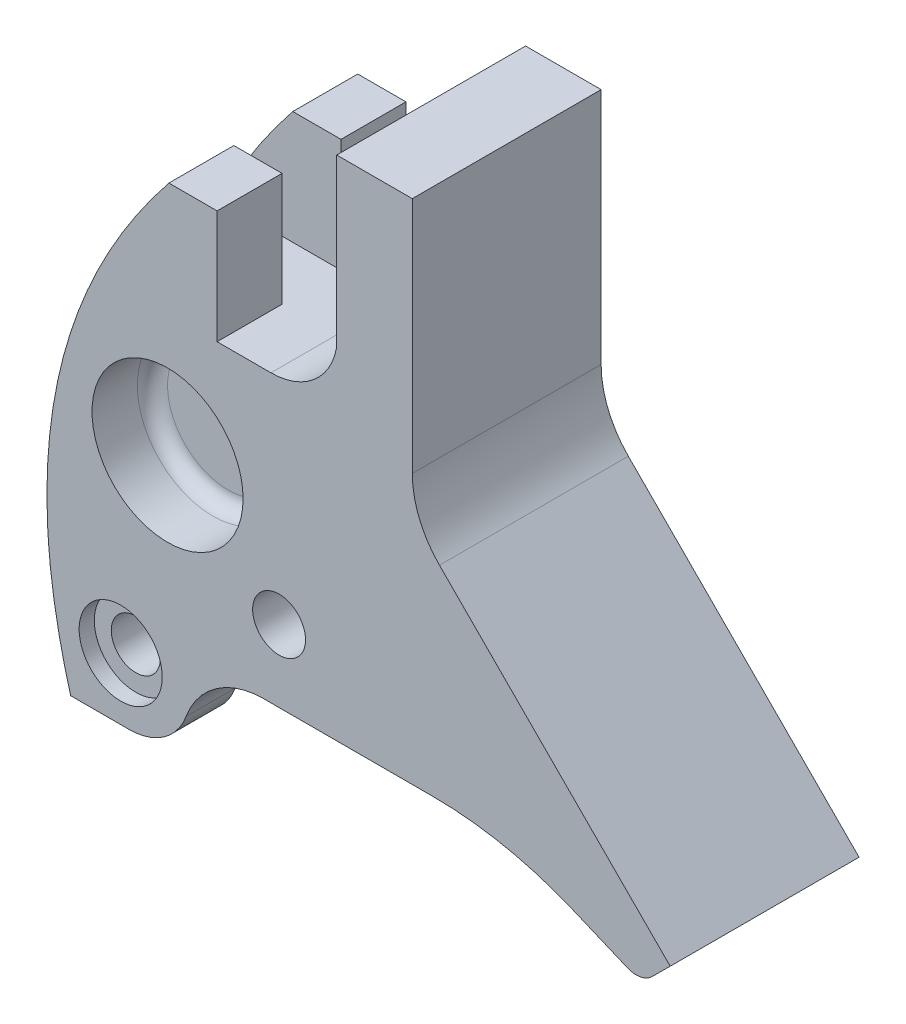
from build123d import *

# Parameters (mm, degrees)
SKETCH1_R           = 3.25
SKETCH1_R_2         = 3.5
BOSS_EXTRUDE1_DEPTH = 25
SKETCH3_W           = 7.8
SKETCH3_H           = 15
CUT_EXTRUDE3_DEPTH  = 15
CUT_EXTRUDE4_START  = -18.5
CUT_EXTRUDE4_DEPTH  = 18.5
BOSS_EXTRUDE2_START = -6.5
BOSS_EXTRUDE2_DEPTH = 6.5
SKETCH7_R           = 3.25
CUT_EXTRUDE5_DEPTH  = 86.008550492
SKETCH8_R           = 5.5
CUT_EXTRUDE6_DEPTH  = 2
SKETCH10_R          = 10
CUT_EXTRUDE7_DEPTH  = 8
CUT_EXTRUDE8_START  = -8
SKETCH11_R          = 10
CUT_EXTRUDE8_DEPTH  = 8
FILLET1_R           = 2
FILLET2_R           = 2


with BuildPart() as part:
    # Sketch1 → Boss-Extrude1 (new body)
    with BuildSketch(Plane.XY):
        with BuildLine():
            Line((-3.368737556, 19.272947817), (27.177553566, -11.429647368))
            Line((27.177553566, -11.429647368), (24.795410566, -13.799663099))
            ThreePointArc((24.795410566, -13.799663099), (23.25360999, -14.617492156), (21.517509092, -14.438754766))
            Line((21.517509092, -14.438754766), (14.379267823, -11.439770213))
            ThreePointArc((14.379267823, -11.439770213), (5.2025075, -8.618115303), (-4.350833027, -7.665040681))
            Line((-4.350833027, -7.665040681), (-26.640796017, -7.665040681))
            ThreePointArc((-26.640796017, -7.665040681), (-32.901531585, -9.634920888), (-36.906381215, -14.834768705))
            ThreePointArc((-36.906381215, -14.834768705), (-39.846549029, -18.652246662), (-44.442879704, -20.098437885))
            Line((-44.442879704, -20.098437885), (-52.185319845, -20.098437885))
            add(Edge.make_bspline(
                [(-39.185319845, 45.177729484), (-62.456542346, 16.162765256), (-52.185319845, -20.098437885)],
                knots=[0, 0, 0, 1, 1, 1], degree=2))
            Line((-39.185319845, 45.177729484), (-32.803632074, 45.177729484))
            Line((-32.803632074, 45.177729484), (-32.803632074, 30.177729484))
            Line((-32.803632074, 30.177729484), (-25.672376354, 30.177729484))
            ThreePointArc((-25.672376354, 30.177729484), (-19.98544599, 32.250959559), (-16.967117821, 37.497782881))
            Line((-16.967117821, 37.497782881), (-16.967117821, 59.497782881))
            Line((-16.967117821, 59.497782881), (-6.967117821, 59.497782881))
            Line((-6.967117821, 59.497782881), (-6.967117821, 27.99165541))
            ThreePointArc((-6.967117821, 27.99165541), (-6.032166191, 23.275613568), (-3.368737556, 19.272947817))
        make_face()
        with Locations((-45.56496956, -11.899804379)):
            Circle(SKETCH1_R, mode=Mode.SUBTRACT)
        with Locations((-24.599114464, 1.851168132)):
            Circle(SKETCH1_R_2, mode=Mode.SUBTRACT)
    extrude(amount=BOSS_EXTRUDE1_DEPTH)

    # Sketch3 → Cut-Extrude3 (cut)
    with BuildSketch(Plane(origin=(-32.803632074, 0, 0), x_dir=(0, 0, -1), z_dir=(1, 0, 0))):
        with Locations((-12.5, 37.677729484)):
            Rectangle(SKETCH3_W, SKETCH3_H)
    extrude(amount=-CUT_EXTRUDE3_DEPTH, mode=Mode.SUBTRACT)

    # Sketch5 → Cut-Extrude4 (cut)
    with BuildSketch(Plane.XY.offset(25).offset(CUT_EXTRUDE4_START)):
        with BuildLine():
            Line((-52.185319845, -20.098437885), (-44.442879704, -20.098437885))
            ThreePointArc((-44.442879704, -20.098437885), (-39.846549029, -18.652246662), (-36.906381215, -14.834768705))
            ThreePointArc((-36.906381215, -14.834768705), (-32.901531585, -9.634920888), (-26.640796017, -7.665040681))
            add(Edge.make_bspline(
                [(-26.640796017, -7.665040681), (-35.913662801, -5.797345916), (-45.333124552, -5.386978776), (-54.774566491, -6.479066699), (-54.90005769, -6.493847182)],
                knots=[0, 0, 0, 0, 1, 1.013470151, 1.013470151, 1.013470151, 1.013470151], degree=3))
            add(Edge.make_bspline(
                [(-54.90005769, -6.493847182), (-54.160743852, -13.167522678), (-52.185319845, -20.098437885)],
                knots=[0.808188431, 0.808188431, 0.808188431, 1, 1, 1], degree=2))
        make_face()
    extrude(amount=CUT_EXTRUDE4_DEPTH, mode=Mode.SUBTRACT)

    # Sketch5<2> → Boss-Extrude2 (add)
    with BuildSketch(Plane.XY.offset(25).offset(BOSS_EXTRUDE2_START)):
        with BuildLine():
            Line((-52.185319845, -20.098437885), (-44.442879704, -20.098437885))
            ThreePointArc((-44.442879704, -20.098437885), (-39.846549029, -18.652246662), (-36.906381215, -14.834768705))
            ThreePointArc((-36.906381215, -14.834768705), (-32.901531585, -9.634920888), (-26.640796017, -7.665040681))
            add(Edge.make_bspline(
                [(-26.640796017, -7.665040681), (-35.913662801, -5.797345916), (-45.333124552, -5.386978776), (-54.774566491, -6.479066699), (-54.90005769, -6.493847182)],
                knots=[0, 0, 0, 0, 1, 1.013470151, 1.013470151, 1.013470151, 1.013470151], degree=3))
            add(Edge.make_bspline(
                [(-54.90005769, -6.493847182), (-54.160743852, -13.167522678), (-52.185319845, -20.098437885)],
                knots=[0.808188431, 0.808188431, 0.808188431, 1, 1, 1], degree=2))
        make_face()
    extrude(amount=BOSS_EXTRUDE2_DEPTH)

    # Sketch7 → Cut-Extrude5 (cut, through all)
    with BuildSketch(Plane(origin=(0, 0, 0), x_dir=(-1, 0, 0), z_dir=(0, 0, -1))):
        with Locations((45.56496956, -11.899804379)):
            Circle(SKETCH7_R)
    extrude(amount=-CUT_EXTRUDE5_DEPTH, mode=Mode.SUBTRACT)

    # Sketch8 → Cut-Extrude6 (cut)
    with BuildSketch(Plane.XY.offset(25)):
        with Locations((-45.56496956, -11.899804379)):
            Circle(SKETCH8_R)
    extrude(amount=-CUT_EXTRUDE6_DEPTH, mode=Mode.SUBTRACT)

    # Sketch10 → Cut-Extrude7 (cut)
    with BuildSketch(Plane.XY.offset(25)):
        with Locations((-39.362510172, 13.897599955)):
            Circle(SKETCH10_R)
    extrude(amount=-CUT_EXTRUDE7_DEPTH, mode=Mode.SUBTRACT)

    # Sketch11 → Cut-Extrude8 (cut)
    with BuildSketch(Plane(origin=(0, 0, 0), x_dir=(-1, 0, 0), z_dir=(0, 0, -1)).offset(CUT_EXTRUDE8_START)):
        with Locations((39.362510172, 13.897599955)):
            Circle(SKETCH11_R)
    extrude(amount=CUT_EXTRUDE8_DEPTH, mode=Mode.SUBTRACT)

    # Fillet1
    fillet1_edges = [part.edges().sort_by_distance(p)[0] for p in [
        (-29.362510172, 13.897599955, 8),
    ]]
    fillet(fillet1_edges, radius=FILLET1_R)

    # Fillet2
    fillet2_edges = [part.edges().sort_by_distance(p)[0] for p in [
        (-49.362510172, 13.897599955, 17),
    ]]
    fillet(fillet2_edges, radius=FILLET2_R)


solid = part.part
